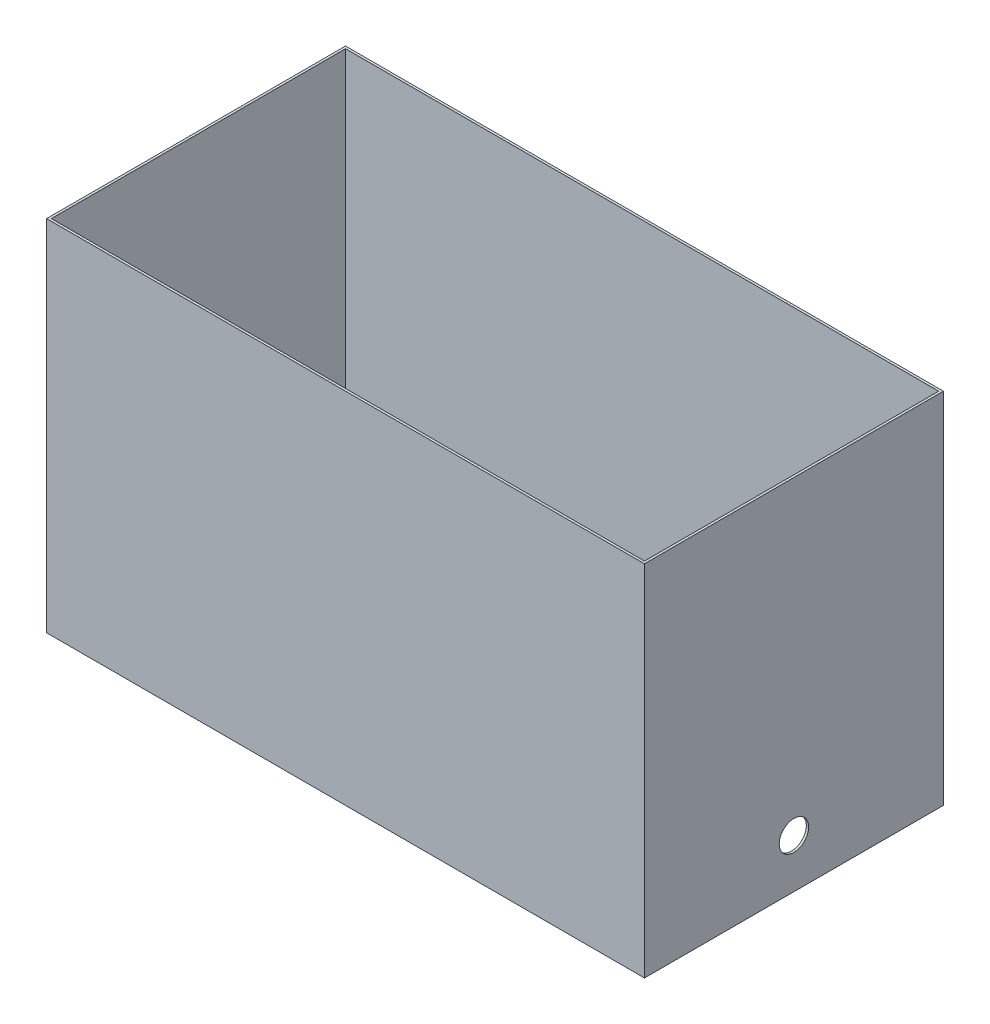
from build123d import *

# Parameters (mm, degrees)
SKETCH1_W           = 508
SKETCH1_H           = 254
SKETCH1_W_2         = 504
SKETCH1_H_2         = 250
BOSS_EXTRUDE1_DEPTH = 304.8
SKETCH2_R           = 12.5
CUT_EXTRUDE1_DEPTH  = 606.884510447


with BuildPart() as part:
    # Sketch1 → Boss-Extrude1 (new body)
    with BuildSketch(Plane(origin=(0, 0, 0), x_dir=(1, 0, 0), z_dir=(0, 1, 0))):
        Rectangle(SKETCH1_W, SKETCH1_H)
        Rectangle(SKETCH1_W_2, SKETCH1_H_2, mode=Mode.SUBTRACT)
    extrude(amount=BOSS_EXTRUDE1_DEPTH)

    # Sketch2 → Cut-Extrude1 (cut, through all)
    with BuildSketch(Plane.ZY.offset(254)):
        with Locations((0, 41.4)):
            Circle(SKETCH2_R)
    extrude(amount=-CUT_EXTRUDE1_DEPTH, mode=Mode.SUBTRACT)


solid = part.part
